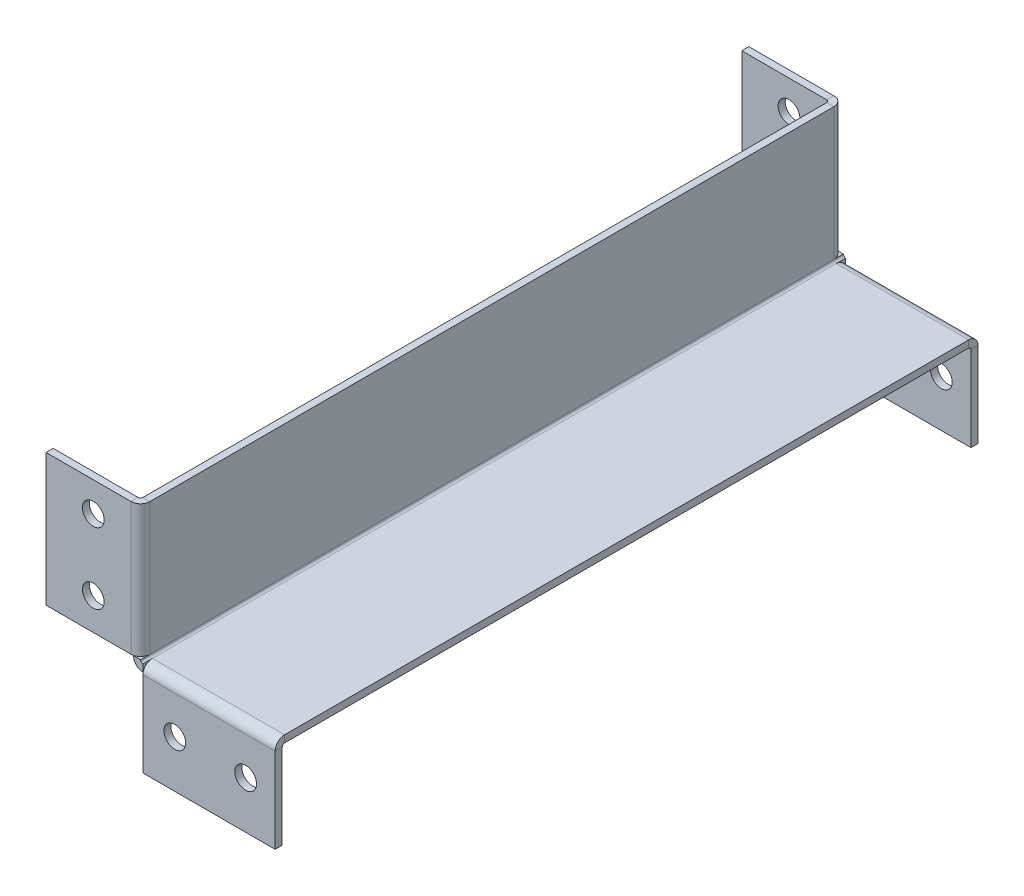
from build123d import *

# Parameters (mm, degrees)
SKETCH1_W                      = 60
SKETCH1_H                      = 297.5
BASE_FLANGE1_DEPTH             = 3
EDGE_FLANGE1_STRIP_W           = 14
EDGE_FLANGE1_STRIP_H           = 3
EDGE_FLANGE1_STRIP_CUT_DEPTH   = 297.5
EDGE_FLANGE1_DEPTH             = 297.5
EDGE_FLANGE2_STRIP_W           = 14
EDGE_FLANGE2_STRIP_H           = 3
EDGE_FLANGE2_STRIP_CUT_DEPTH   = 56
EDGE_FLANGE2_STRIP_2_W         = 14
EDGE_FLANGE2_STRIP_2_H         = 3
EDGE_FLANGE2_STRIP_CUT_2_DEPTH = 56
EDGE_FLANGE2_STRIP_3_W         = 14
EDGE_FLANGE2_STRIP_3_H         = 3
EDGE_FLANGE2_STRIP_CUT_3_DEPTH = 56
EDGE_FLANGE2_STRIP_4_W         = 14
EDGE_FLANGE2_STRIP_4_H         = 3
EDGE_FLANGE2_STRIP_CUT_4_DEPTH = 56
EDGE_FLANGE2_DEPTH             = 56
EDGE_FLANGE2_BEND_DEPTH        = 56
EDGE_FLANGE2_BEND_2_DEPTH      = 56
EDGE_FLANGE2_BEND_3_DEPTH      = 56
SKETCH18_R                     = 4.6
EXTRUDE1_DEPTH                 = 311.797763827


# Sheet-metal steps are written as plain solids
with BuildPart() as part:
    # Sketch1 → Base-Flange1 (new body)
    with BuildSketch(Plane(origin=(0, 0, 0), x_dir=(1, 0, 0), z_dir=(0, 1, 0))):
        Rectangle(SKETCH1_W, SKETCH1_H)
    extrude(amount=BASE_FLANGE1_DEPTH)

    # Edge-Flange1 strip (across the edge) → Edge-Flange1 strip cut (cut)
    with BuildSketch(Plane(origin=(-30, 3, -148.75), x_dir=(1, 0, 0), z_dir=(0, 0, 1))):
        with Locations((-3, -1.5)):
            Rectangle(EDGE_FLANGE1_STRIP_W, EDGE_FLANGE1_STRIP_H)
    extrude(amount=EDGE_FLANGE1_STRIP_CUT_DEPTH, mode=Mode.SUBTRACT)

    # Edge-Flange1 section (across the edge) → Edge-Flange1 (add)
    with BuildSketch(Plane(origin=(-30, 3, -148.75), x_dir=(1, 0, 0), z_dir=(0, 0, 1))):
        with BuildLine():
            Line((0, 1), (0, 57))
            Line((0, 57), (3, 57))
            Line((3, 57), (3, 1))
            ThreePointArc((3, 1), (3.292893219, 0.292893219), (4, 0))
            Line((4, 0), (4, -3))
            ThreePointArc((4, -3), (1.171572875, -1.828427125), (0, 1))
        make_face()
    extrude(amount=EDGE_FLANGE1_DEPTH)

    # Edge-Flange2 strip (across the edge) → Edge-Flange2 strip cut (cut)
    with BuildSketch(Plane(origin=(-30, 4, 148.75), x_dir=(0, 0, -1), z_dir=(0, 1, 0))):
        with Locations((-3, -1.5)):
            Rectangle(EDGE_FLANGE2_STRIP_W, EDGE_FLANGE2_STRIP_H)
    extrude(amount=EDGE_FLANGE2_STRIP_CUT_DEPTH, mode=Mode.SUBTRACT)

    # Edge-Flange2 strip 2 (across the edge) → Edge-Flange2 strip cut 2 (cut)
    with BuildSketch(Plane(origin=(30, 0, 148.75), x_dir=(0, 0, -1), z_dir=(-1, 0, 0))):
        with Locations((-3, -1.5)):
            Rectangle(EDGE_FLANGE2_STRIP_2_W, EDGE_FLANGE2_STRIP_2_H)
    extrude(amount=EDGE_FLANGE2_STRIP_CUT_2_DEPTH, mode=Mode.SUBTRACT)

    # Edge-Flange2 strip 3 (across the edge) → Edge-Flange2 strip cut 3 (cut)
    with BuildSketch(Plane(origin=(-30, 60, -148.75), x_dir=(0, 0, 1), z_dir=(0, -1, 0))):
        with Locations((-3, -1.5)):
            Rectangle(EDGE_FLANGE2_STRIP_3_W, EDGE_FLANGE2_STRIP_3_H)
    extrude(amount=EDGE_FLANGE2_STRIP_CUT_3_DEPTH, mode=Mode.SUBTRACT)

    # Edge-Flange2 strip 4 (across the edge) → Edge-Flange2 strip cut 4 (cut)
    with BuildSketch(Plane(origin=(-26, 0, -148.75), x_dir=(0, 0, 1), z_dir=(1, 0, 0))):
        with Locations((-3, -1.5)):
            Rectangle(EDGE_FLANGE2_STRIP_4_W, EDGE_FLANGE2_STRIP_4_H)
    extrude(amount=EDGE_FLANGE2_STRIP_CUT_4_DEPTH, mode=Mode.SUBTRACT)

    # Edge-Flange2 section (across the edge) → Edge-Flange2 (add)
    with BuildSketch(Plane(origin=(-30, 4, 148.75), x_dir=(0, 0, -1), z_dir=(0, 1, 0))):
        with BuildLine():
            Line((0, 1), (0, 37))
            Line((0, 37), (3, 37))
            Line((3, 37), (3, 1))
            ThreePointArc((3, 1), (3.292893219, 0.292893219), (4, 0))
            Line((4, 0), (4, -3))
            ThreePointArc((4, -3), (1.171572875, -1.828427125), (0, 1))
        make_face()
    extrude(amount=EDGE_FLANGE2_DEPTH)

    # Edge-Flange2 section 2 (across the edge) → Edge-Flange2 bend (add)
    with BuildSketch(Plane(origin=(30, 0, 148.75), x_dir=(0, 0, -1), z_dir=(-1, 0, 0))):
        with BuildLine():
            Line((0, 1), (0, 37))
            Line((0, 37), (3, 37))
            Line((3, 37), (3, 1))
            ThreePointArc((3, 1), (3.292893219, 0.292893219), (4, 0))
            Line((4, 0), (4, -3))
            ThreePointArc((4, -3), (1.171572875, -1.828427125), (0, 1))
        make_face()
    extrude(amount=EDGE_FLANGE2_BEND_DEPTH)

    # Edge-Flange2 section 3 (across the edge) → Edge-Flange2 bend 2 (add)
    with BuildSketch(Plane(origin=(-30, 60, -148.75), x_dir=(0, 0, 1), z_dir=(0, -1, 0))):
        with BuildLine():
            Line((0, 1), (0, 37))
            Line((0, 37), (3, 37))
            Line((3, 37), (3, 1))
            ThreePointArc((3, 1), (3.292893219, 0.292893219), (4, 0))
            Line((4, 0), (4, -3))
            ThreePointArc((4, -3), (1.171572875, -1.828427125), (0, 1))
        make_face()
    extrude(amount=EDGE_FLANGE2_BEND_2_DEPTH)

    # Edge-Flange2 section 4 (across the edge) → Edge-Flange2 bend 3 (add)
    with BuildSketch(Plane(origin=(-26, 0, -148.75), x_dir=(0, 0, 1), z_dir=(1, 0, 0))):
        with BuildLine():
            Line((0, 1), (0, 37))
            Line((0, 37), (3, 37))
            Line((3, 37), (3, 1))
            ThreePointArc((3, 1), (3.292893219, 0.292893219), (4, 0))
            Line((4, 0), (4, -3))
            ThreePointArc((4, -3), (1.171572875, -1.828427125), (0, 1))
        make_face()
    extrude(amount=EDGE_FLANGE2_BEND_3_DEPTH)

    # Sketch18 → Extrude1 (cut, through all)
    with BuildSketch(Plane.XY.offset(148.75)):
        with Locations((-47, 47.5)):
            Circle(SKETCH18_R)
        with Locations((-47, 17.5)):
            Circle(SKETCH18_R)
        with Locations((-12.5, -17)):
            Circle(SKETCH18_R)
        with Locations((17.5, -17)):
            Circle(SKETCH18_R)
    extrude(amount=-EXTRUDE1_DEPTH, mode=Mode.SUBTRACT)


solid = part.part
